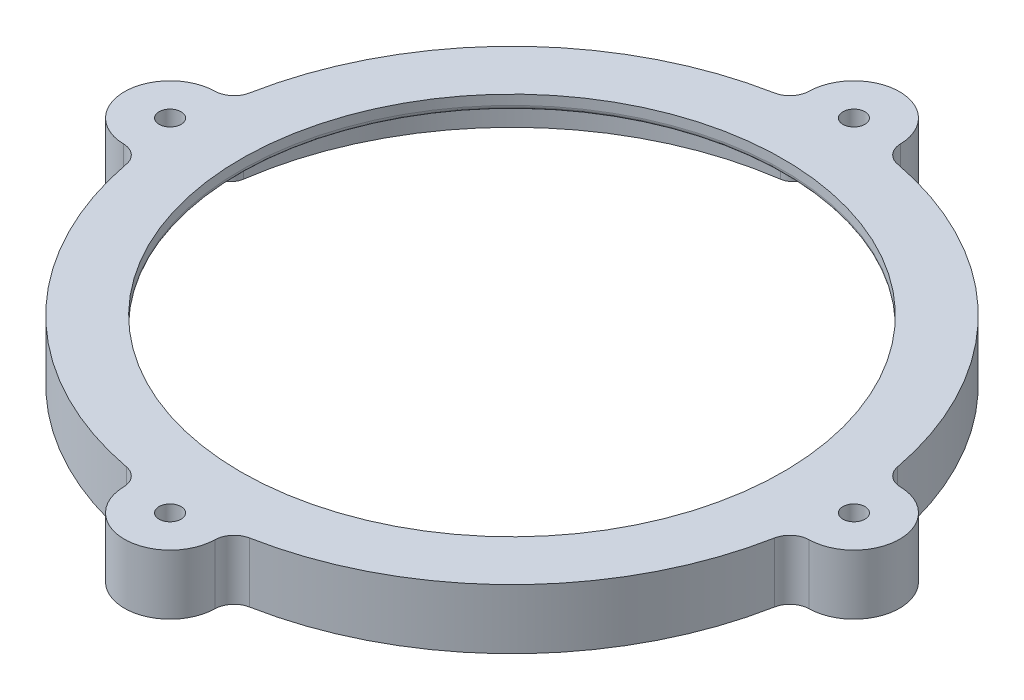
from build123d import *
from build123d.topology import SkipClean

# Parameters (mm, degrees)
FILLET1_R                = 1
BOSS_EXTRUDE1_DEPTH      = 4.75
FILLET2_R                = 2
M4_CLEARANCE_HOLE1_D     = 4.5
CIRPATTERN3_COUNT        = 4
FILLET2_OF_CIRPATTERN3_R = 2
BOSS_EXTRUDE2_START      = 7.5
BOSS_EXTRUDE2_DEPTH      = 7.5
BOSS_EXTRUDE3_START      = -4.75
SKETCH10_R               = 2.25
BOSS_EXTRUDE3_DEPTH      = 4.75
FILLET3_R                = 4
FILLET4_R                = 3


with BuildPart() as part:
    # Sketch1 → Revolve1 (revolve)
    with BuildSketch(Plane.XY, mode=Mode.PRIVATE) as revolve1_sk:
        Polygon((64.5, 0), (64.5, 1.75), (55.5, 1.75), (55.5, 4.75), (67.5, 4.75), (67.5, 0), align=None)
    revolve(revolve1_sk.sketch.rotate(Axis((0, 4.75, 0), (0, -1, 0)), 90), axis=Axis((0, 4.75, 0), (0, -1, 0)))

    # Fillet1
    fillet1_edges = [part.edges().sort_by_distance(p)[0] for p in [
        (0, 1.75, -55.5),
    ]]
    fillet(fillet1_edges, radius=FILLET1_R)

    # Sketch2 → Boss-Extrude1 (add)
    with BuildSketch(Plane(origin=(0, 4.75, 0), x_dir=(1, 0, 0), z_dir=(0, 1, 0))):
        with BuildLine():
            Line((67.232804493, 6), (70, 6))
            ThreePointArc((70, 6), (76, 0), (70, -6))
            Line((70, -6), (67.232804493, -6))
            Line((67.232804493, -6), (67.232804493, 6))
        make_face()
    boss_extrude1 = extrude(amount=-BOSS_EXTRUDE1_DEPTH)

    # Fillet2
    fillet2_edges = [part.edges().sort_by_distance(p)[0] for p in [
        (67.232804493, 2.375, 6),
        (67.232804493, 2.375, -6),
    ]]
    fillet(fillet2_edges, radius=FILLET2_R)

    # M4 Clearance Hole1 (through all)
    with Locations(Plane(origin=(0, 4.75, 0), x_dir=(1, 0, 0), z_dir=(0, 1, 0))):
        with Locations((70, 0)):
            m4_clearance_hole1 = Hole(M4_CLEARANCE_HOLE1_D / 2)

    # CirPattern3: Boss-Extrude1, M4 Clearance Hole1 ×4 about axis
    cirpattern3_axis = Axis((0, 0, 0), (0, 1, 0))
    add([boss_extrude1.rotate(cirpattern3_axis, i * 360 / CIRPATTERN3_COUNT) for i in range(1, CIRPATTERN3_COUNT)])
    add([m4_clearance_hole1.rotate(cirpattern3_axis, i * 360 / CIRPATTERN3_COUNT) for i in range(1, CIRPATTERN3_COUNT)], mode=Mode.SUBTRACT)

    # Fillet2 of CirPattern3
    fillet2_of_cirpattern3_edges = [part.edges().sort_by_distance(p)[0] for p in [
        (6, 2.375, -67.232804493),
        (-6, 2.375, -67.232804493),
        (-67.232804493, 2.375, -6),
        (-67.232804493, 2.375, 6),
        (-6, 2.375, 67.232804493),
        (6, 2.375, 67.232804493),
    ]]
    fillet(fillet2_of_cirpattern3_edges, radius=FILLET2_OF_CIRPATTERN3_R)

    # Sketch9 → Boss-Extrude2 (add)
    with SkipClean():  # the faces are left unmerged after this step: merging them gives an invalid solid
        with BuildSketch(Plane.XZ.offset(BOSS_EXTRUDE2_START)):
            with BuildLine():
                Line((9.35, 70), (9.35, 66.84928945))
                ThreePointArc((9.35, 66.84928945), (47.72970773, 47.72970773), (66.84928945, 9.35))
                Line((66.84928945, 9.35), (70, 9.35))
                ThreePointArc((70, 9.35), (79.35, 0), (70, -9.35))
                Line((70, -9.35), (66.84928945, -9.35))
                ThreePointArc((66.84928945, -9.35), (47.72970773, -47.72970773), (9.35, -66.84928945))
                Line((9.35, -66.84928945), (9.35, -70))
                ThreePointArc((9.35, -70), (0, -79.35), (-9.35, -70))
                Line((-9.35, -70), (-9.35, -66.84928945))
                ThreePointArc((-9.35, -66.84928945), (-47.72970773, -47.72970773), (-66.84928945, -9.35))
                Line((-66.84928945, -9.35), (-70, -9.35))
                ThreePointArc((-70, -9.35), (-79.35, 0), (-70, 9.35))
                Line((-70, 9.35), (-66.84928945, 9.35))
                ThreePointArc((-66.84928945, 9.35), (-47.72970773, 47.72970773), (-9.35, 66.84928945))
                Line((-9.35, 66.84928945), (-9.35, 70))
                ThreePointArc((-9.35, 70), (0, 79.35), (9.35, 70))
            make_face()
            with BuildLine():
                Line((6.35, 70), (6.35, 64.186661387))
                ThreePointArc((6.35, 64.186661387), (6.887471884, 64.131214951), (7.424460432, 64.071268033))
                ThreePointArc((7.424460432, 64.071268033), (45.608387387, 45.608387387), (64.071268033, 7.424460432))
                ThreePointArc((64.071268033, 7.424460432), (64.131214951, 6.887471884), (64.186661387, 6.35))
                Line((64.186661387, 6.35), (70, 6.35))
                ThreePointArc((70, 6.35), (76.35, 0), (70, -6.35))
                Line((70, -6.35), (64.186661387, -6.35))
                ThreePointArc((64.186661387, -6.35), (45.608387387, -45.608387387), (6.35, -64.186661387))
                Line((6.35, -64.186661387), (6.35, -70))
                ThreePointArc((6.35, -70), (0, -76.35), (-6.35, -70))
                Line((-6.35, -70), (-6.35, -64.186661387))
                ThreePointArc((-6.35, -64.186661387), (-6.887471884, -64.131214951), (-7.424460432, -64.071268033))
                ThreePointArc((-7.424460432, -64.071268033), (-45.608387387, -45.608387387), (-64.071268033, -7.424460432))
                ThreePointArc((-64.071268033, -7.424460432), (-64.131214951, -6.887471884), (-64.186661387, -6.35))
                Line((-64.186661387, -6.35), (-70, -6.35))
                ThreePointArc((-70, -6.35), (-76.35, 0), (-70, 6.35))
                Line((-70, 6.35), (-64.186661387, 6.35))
                ThreePointArc((-64.186661387, 6.35), (-45.608387387, 45.608387387), (-6.35, 64.186661387))
                Line((-6.35, 64.186661387), (-6.35, 70))
                ThreePointArc((-6.35, 70), (0, 76.35), (6.35, 70))
            make_face(mode=Mode.SUBTRACT)
        extrude(amount=-BOSS_EXTRUDE2_DEPTH)

    # Sketch10 → Boss-Extrude3 (add)
    # profile 1 of 4: a face of its own
    with SkipClean():  # the faces are left unmerged after this step: merging them gives an invalid solid
        with BuildSketch(Plane(origin=(0, 4.75, 0), x_dir=(1, 0, 0), z_dir=(0, 1, 0)).offset(BOSS_EXTRUDE3_START)):
            with BuildLine():
                Line((9.35, -70), (9.35, -66.84928945))
                ThreePointArc((9.35, -66.84928945), (8.560488148, -66.954970261), (7.769784173, -67.051327011))
                ThreePointArc((7.769784173, -67.051327011), (-0.796539584, -67.495300019), (-9.35, -66.84928945))
                Line((-9.35, -66.84928945), (-9.35, -70))
                ThreePointArc((-9.35, -70), (0, -79.35), (9.35, -70))
            make_face()
            with Locations(Location((0, -70, 0), (0, 0, 270))):
                Circle(SKETCH10_R, mode=Mode.SUBTRACT)
        # profile 2 of 4: a face of its own
        with BuildSketch(Plane(origin=(0, 4.75, 0), x_dir=(1, 0, 0), z_dir=(0, 1, 0)).offset(BOSS_EXTRUDE3_START)):
            with BuildLine():
                Line((-70, -9.35), (-66.84928945, -9.35))
                ThreePointArc((-66.84928945, -9.35), (-67.495300019, -0.796539584), (-67.051327011, 7.769784173))
                ThreePointArc((-67.051327011, 7.769784173), (-66.954970261, 8.560488148), (-66.84928945, 9.35))
                Line((-66.84928945, 9.35), (-70, 9.35))
                ThreePointArc((-70, 9.35), (-79.35, 0), (-70, -9.35))
            make_face()
            with Locations(Location((-70, 0, 0), (0, 0, 270))):
                Circle(SKETCH10_R, mode=Mode.SUBTRACT)
        # profile 3 of 4: a face of its own
        with BuildSketch(Plane(origin=(0, 4.75, 0), x_dir=(1, 0, 0), z_dir=(0, 1, 0)).offset(BOSS_EXTRUDE3_START)):
            with BuildLine():
                Line((66.84928945, -9.35), (70, -9.35))
                ThreePointArc((70, -9.35), (79.35, 0), (70, 9.35))
                Line((70, 9.35), (66.84928945, 9.35))
                ThreePointArc((66.84928945, 9.35), (67.495300019, 0.796539584), (67.051327011, -7.769784173))
                ThreePointArc((67.051327011, -7.769784173), (66.954970261, -8.560488148), (66.84928945, -9.35))
            make_face()
            with Locations(Location((70, 0, 0), (0, 0, 270))):
                Circle(SKETCH10_R, mode=Mode.SUBTRACT)
        # profile 4 of 4: a face of its own
        with BuildSketch(Plane(origin=(0, 4.75, 0), x_dir=(1, 0, 0), z_dir=(0, 1, 0)).offset(BOSS_EXTRUDE3_START)):
            with BuildLine():
                Line((-9.35, 70), (-9.35, 66.84928945))
                ThreePointArc((-9.35, 66.84928945), (-0.796539584, 67.495300019), (7.769784173, 67.051327011))
                ThreePointArc((7.769784173, 67.051327011), (8.560488148, 66.954970261), (9.35, 66.84928945))
                Line((9.35, 66.84928945), (9.35, 70))
                ThreePointArc((9.35, 70), (0, 79.35), (-9.35, 70))
            make_face()
            with Locations(Location((0, 70, 0), (0, 0, 270))):
                Circle(SKETCH10_R, mode=Mode.SUBTRACT)
        extrude(amount=BOSS_EXTRUDE3_DEPTH)

    # Fillet3
    # the kernel refuses this fillet: 4 mm, written as the material it adds along each edge
    with BuildSketch(Plane(origin=(9.35, -7.5, -66.84928945), x_dir=(0.9866840130095414, 0, 0.1626488809410843), z_dir=(0, 1, 0)), Plane(origin=(-66.84928945, -7.5, -9.35), x_dir=(0.16264888094108318, 0, -0.9866840130095416), z_dir=(0, 1, 0)), Plane(origin=(66.84928945, -7.5, 9.35), x_dir=(-0.16264888094108712, 0, 0.986684013009541), z_dir=(0, 1, 0))) as fillet3_piece_1:
        with BuildLine():
            CenterArc((3.392560849, 3.998808428), FILLET3_R, 190.403879818, 78.197568224)
            Line((-0.54167613, 3.276465436), (-0.935099828, 3.204231137))
            ThreePointArc((-0.935099828, 3.204231137), (-0.90713315, 3.043696177), (-0.394673605, -0.065059552))
            Line((-0.394673605, -0.065059552), (0.009762765, -0.399880843))
            ThreePointArc((0.009762765, -0.399880843), (1.647466599, -0.379892218), (3.285170433, -0.399880843))
            Line((3.285170433, -0.399880843), (3.294933198, 0))
        make_face()
    extrude(amount=7.5)
    with BuildSketch(Plane(origin=(-9.35, -7.5, -66.84928945), x_dir=(0.00046665737590304566, 0, -0.9999998911154409), z_dir=(0, 1, 0)), Plane(origin=(-66.84928945, -7.5, 9.35), x_dir=(-0.9999998911154409, 0, -0.00046665737590358055), z_dir=(0, 1, 0)), Plane(origin=(9.35, -7.5, 66.84928945), x_dir=(-0.00046665737546071475, 0, 0.999999891115441), z_dir=(0, 1, 0)), Plane(origin=(66.84928945, -7.5, -9.35), x_dir=(0.9999998911154409, 0, 0.00046665737590465234), z_dir=(0, 1, 0))) as fillet3_piece_2:
        with BuildLine():
            CenterArc((3.391898155, 3.999370558), FILLET3_R, 190.785969778, 78.197568224)
            Line((-0.537434269, 3.250807467), (-0.930367512, 3.175951158))
            ThreePointArc((-0.930367512, 3.175951158), (-0.643521838, 1.563439777), (-0.396118038, -0.055592265))
            Line((-0.396118038, -0.055592265), (0.000186663, -0.399999956))
            ThreePointArc((0.000186663, -0.399999956), (3.15089687, -0.398529654), (3.313843571, -0.399937056))
            Line((3.313843571, -0.399937056), (3.320939443, 0))
        make_face()
    extrude(amount=7.5)
    with BuildSketch(Plane(origin=(-9.35, -7.5, 66.84928945), x_dir=(0.00046665737590197983, 0, 0.9999998911154409), z_dir=(0, 1, 0))) as fillet3_piece_3:
        with BuildLine():
            CenterArc((3.391898155, -3.999370558), FILLET3_R, 91.016461998, 78.197568224)
            Line((-0.537434269, -3.250807467), (-0.930367512, -3.175951158))
            ThreePointArc((-0.930367512, -3.175951158), (-0.643521838, -1.563439777), (-0.396118038, 0.055592265))
            Line((-0.396118038, 0.055592265), (0.000186663, 0.399999956))
            ThreePointArc((0.000186663, 0.399999956), (3.15089687, 0.398529654), (3.313843571, 0.399937056))
            Line((3.313843571, 0.399937056), (3.320939443, 0))
        make_face()
    extrude(amount=7.5)
    with BuildSketch(Plane(origin=(66.84928945, 0, -9.35), x_dir=(0.9999998911154409, 0, 0.00046665737590465234), z_dir=(0, 1, 0)), Plane(origin=(9.35, 0, 66.84928945), x_dir=(-0.00046665737546125165, 0, 0.999999891115441), z_dir=(0, 1, 0)), Plane(origin=(-66.84928945, 0, 9.35), x_dir=(-0.9999998911154409, 0, -0.0004666573759035825), z_dir=(0, 1, 0)), Plane(origin=(-9.35, 0, -66.84928945), x_dir=(0.0004666573759025147, 0, -0.9999998911154409), z_dir=(0, 1, 0))) as fillet3_piece_4:
        with BuildLine():
            CenterArc((3.391898155, 3.999370558), FILLET3_R, 190.785969778, 78.197568224)
            Line((-0.537434269, 3.250807467), (-0.930367512, 3.175951158))
            ThreePointArc((-0.930367512, 3.175951158), (-0.643521838, 1.563439777), (-0.396118038, -0.055592265))
            Line((-0.396118038, -0.055592265), (0.000186663, -0.399999956))
            ThreePointArc((0.000186663, -0.399999956), (3.15089687, -0.398529654), (3.313843571, -0.399937056))
            Line((3.313843571, -0.399937056), (3.320939443, 0))
        make_face()
    extrude(amount=4.75)
    with BuildSketch(Plane(origin=(66.84928945, 0, 9.35), x_dir=(-0.16264888094109056, 0, 0.9866840130095405), z_dir=(0, 1, 0)), Plane(origin=(-66.84928945, 0, -9.35), x_dir=(0.16264888094108695, 0, -0.986684013009541), z_dir=(0, 1, 0)), Plane(origin=(9.35, 0, -66.84928945), x_dir=(0.9866840130095401, 0, 0.16264888094109253), z_dir=(0, 1, 0))) as fillet3_piece_5:
        with BuildLine():
            CenterArc((3.392560849, 3.998808428), FILLET3_R, 190.403879818, 78.197568224)
            Line((-0.54167613, 3.276465436), (-0.935099828, 3.204231137))
            ThreePointArc((-0.935099828, 3.204231137), (-0.90713315, 3.043696177), (-0.394673605, -0.065059552))
            Line((-0.394673605, -0.065059552), (0.009762765, -0.399880843))
            ThreePointArc((0.009762765, -0.399880843), (1.647466599, -0.379892218), (3.285170433, -0.399880843))
            Line((3.285170433, -0.399880843), (3.294933198, 0))
        make_face()
    extrude(amount=4.75)
    with BuildSketch(Plane(origin=(-9.35, 0, 66.84928945), x_dir=(0.0004666573759067919, 0, 0.9999998911154409), z_dir=(0, 1, 0))) as fillet3_piece_6:
        with BuildLine():
            CenterArc((3.391898155, -3.999370558), FILLET3_R, 91.016461998, 78.197568224)
            Line((-0.537434269, -3.250807467), (-0.930367512, -3.175951158))
            ThreePointArc((-0.930367512, -3.175951158), (-0.643521838, -1.563439777), (-0.396118038, 0.055592265))
            Line((-0.396118038, 0.055592265), (0.000186663, 0.399999956))
            ThreePointArc((0.000186663, 0.399999956), (3.15089687, 0.398529654), (3.313843571, 0.399937056))
            Line((3.313843571, 0.399937056), (3.320939443, 0))
        make_face()
    extrude(amount=4.75)

    # Fillet4
    # the kernel refuses this fillet: 3 mm, written as the material it takes off along each edge
    with BuildSketch(Plane(origin=(6.35, -14.156570159, 64.186661387), x_dir=(0, 0, 1), z_dir=(0, 1, 0))) as fillet4_piece_1:
        with BuildLine():
            CenterArc((2.662628063, 3), FILLET4_R, 187.962128364, 82.037871636)
            ThreePointArc((-0.308451468, 2.584444444), (-0.141188058, 1.293778259), (0, 0))
            Line((0, 0), (2.662628063, 0))
        make_face()
    extrude(amount=14.156570159, mode=Mode.SUBTRACT)
    with BuildSketch(Plane(origin=(-6.35, -14.156570158, 64.186661387), x_dir=(-0.9929530748674341, 0, -0.11850819006004458), z_dir=(0, 1, 0)), Plane(origin=(6.35, -14.156570158, -64.186661387), x_dir=(0.9929530748674334, 0, 0.11850819006005012), z_dir=(0, 1, 0))) as fillet4_piece_2:
        with BuildLine():
            CenterArc((2.663315992, 2.999389293), FILLET4_R, 186.806013808, 82.037871636)
            Line((-0.315543233, 2.643864723), (0, 0))
            ThreePointArc((0, 0), (1.301393042, 0.013130203), (2.602786083, 0))
        make_face()
    extrude(amount=14.156570158, mode=Mode.SUBTRACT)
    with BuildSketch(Plane(origin=(-64.186661387, -14.156570158, 6.35), x_dir=(0.11850819006005611, 0, 0.9929530748674328), z_dir=(0, 1, 0)), Plane(origin=(64.186661387, -14.156570158, -6.35), x_dir=(-0.11850819006006143, 0, -0.9929530748674322), z_dir=(0, 1, 0))) as fillet4_piece_3:
        with BuildLine():
            CenterArc((2.663315992, -2.999389293), FILLET4_R, 91.156114556, 82.037871636)
            Line((-0.315543233, -2.643864723), (0, 0))
            ThreePointArc((0, 0), (1.301393042, -0.013130203), (2.602786083, 0))
        make_face()
    extrude(amount=14.156570158, mode=Mode.SUBTRACT)
    with BuildSketch(Plane(origin=(-64.186661387, -14.156570158, -6.35), x_dir=(-1, 0, 0), z_dir=(0, 1, 0)), Plane(origin=(64.186661387, -14.156570158, 6.35), x_dir=(1, 0, 0), z_dir=(0, 1, 0))) as fillet4_piece_4:
        with BuildLine():
            CenterArc((2.662628063, -3), FILLET4_R, 90, 82.037871636)
            ThreePointArc((-0.308451468, -2.584444444), (-0.141188058, -1.293778259), (0, 0))
            Line((0, 0), (2.662628063, 0))
        make_face()
    extrude(amount=14.156570158, mode=Mode.SUBTRACT)
    with BuildSketch(Plane(origin=(-6.35, -14.156570159, -64.186661387), x_dir=(-0.9929530748668933, 0, 0.11850819006457661), z_dir=(0, 1, 0))) as fillet4_piece_5:
        with BuildLine():
            CenterArc((2.663315992, -2.999389293), FILLET4_R, 91.156114556, 82.037871636)
            Line((-0.315543233, -2.643864723), (0, 0))
            ThreePointArc((0, 0), (1.301393042, -0.013130203), (2.602786083, 0))
        make_face()
    extrude(amount=14.156570159, mode=Mode.SUBTRACT)


solid = part.part
